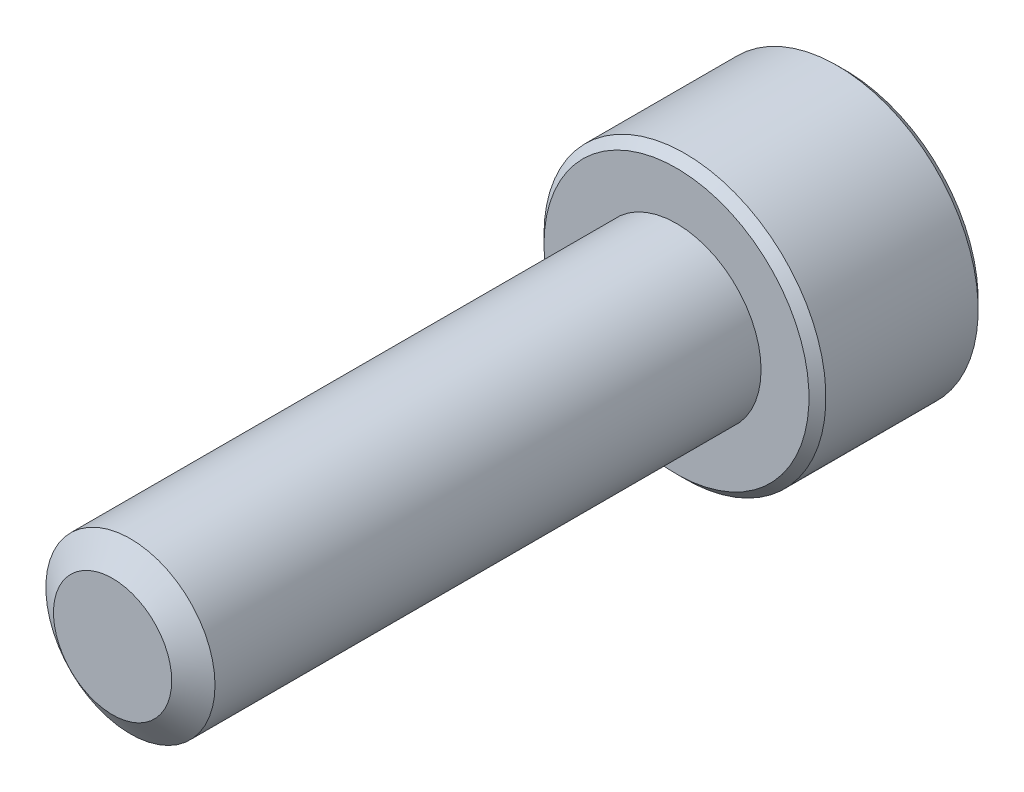
from build123d import *

# Parameters (mm, degrees)
SKETCH1_R          = 3
EXTRUDE1_DEPTH     = 20
SKETCH6_R          = 5
EXTRUDE2_DEPTH     = 6
CUT_EXTRUDE1_DEPTH = 3.75
CHAMFER1_SIZE      = 0.3


with BuildPart() as part:
    # Sketch1 → Extrude1 (new body)
    with BuildSketch(Plane.XY):
        Circle(SKETCH1_R)
    extrude(amount=-EXTRUDE1_DEPTH)

    # Sketch4 → Cut-Revolve1 (revolve, cut)
    with BuildSketch(Plane(origin=(0, 0, 0), x_dir=(0, 0, -1), z_dir=(1, 0, 0))):
        Polygon((0.632650852, 3), (0, 2.096480947), (0, 3), align=None)
    revolve(axis=Axis((0, 0, 0), (0, 0, -1)), mode=Mode.SUBTRACT)

    # Sketch6 → Extrude2 (add)
    with BuildSketch(Plane(origin=(0, 0, -20), x_dir=(-1, 0, 0), z_dir=(0, 0, -1))):
        Circle(SKETCH6_R)
    extrude(amount=EXTRUDE2_DEPTH)

    # Sketch7 → Cut-Extrude1 (cut)
    with BuildSketch(Plane(origin=(0, 0, -26), x_dir=(-1, 0, 0), z_dir=(0, 0, -1))):
        Polygon((0, 2.886751346), (-2.5, 1.443375673), (-2.5, -1.443375673), (0, -2.886751346), (2.5, -1.443375673), (2.5, 1.443375673), align=None)
    extrude(amount=-CUT_EXTRUDE1_DEPTH, mode=Mode.SUBTRACT)

    # Cut-Extrude2 cone 1 section (through the dimple's axis) → Cut-Extrude2 (revolve, cut)
    with BuildSketch(Plane(origin=(0, 0, -26), x_dir=(0, 1, 0), z_dir=(1, 0, 0))):
        Polygon((0, 0), (2.886751346, 0), (0, 2.886751346), align=None)
    revolve(axis=Axis((0, 0, -26), (0, 0, 1)), mode=Mode.SUBTRACT)

    # Chamfer1
    chamfer1_edges = [part.edges().sort_by_distance(p)[0] for p in [
        (5, 0, -26),
        (5, 0, -20),
    ]]
    chamfer(chamfer1_edges, length=CHAMFER1_SIZE)

    # Sketch10 → Revolve1 (revolve)
    with BuildSketch(Plane(origin=(0, 0, 0), x_dir=(0, 0, -1), z_dir=(1, 0, 0))):
        Polygon((20, 3), (20, 0), (18.507359313, 0), (19.75, 3), align=None)
    revolve(axis=Axis((0, 0, -20), (0, 0, 1)))


solid = part.part
